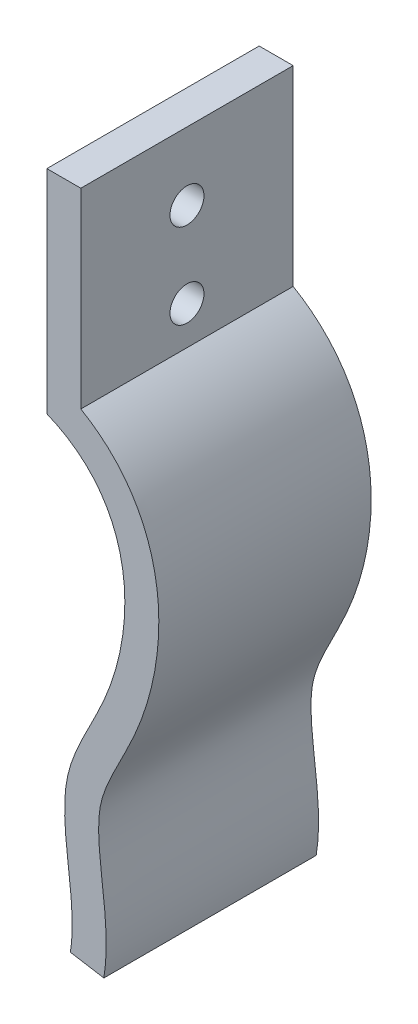
from build123d import *

# Parameters (mm, degrees)
Y_KSEKLIK_EKSTR_ZYON1_DEPTH = 25
IZIM2_R                     = 2
KES_EKSTR_ZYON1_DEPTH       = 25


with BuildPart() as part:
    # Çizim1 → Yükseklik-Ekstrüzyon1 (new body)
    with BuildSketch(Plane.XY):
        with BuildLine():
            Line((0, 46.809932088), (0, 21.809932088))
            add(Edge.make_bspline(
                [(0, 21.809932088), (10.568682784, 17.485267601), (10.861510075, 0.820586193), (0.998345772, -13.725400391), (2.795894005, -23.640205996), (3.121098113, -29.579949129), (2.768427288, -31.706876061)],
                knots=[0, 0, 0, 0, 0.502231834, 0.695448005, 0.885832632, 1, 1, 1, 1], degree=3))
            Line((2.768427288, -31.706876061), (6.714548286, -32.36119179))
            add(Edge.make_bspline(
                [(4, 24.2963952), (4.685241485, 23.900375179), (6.022043302, 23.011317955), (8.333925315, 20.992557914), (10.609017408, 18.030861677), (12.32636561, 14.066160517), (13.159459329, 9.910750093), (13.24989148, 5.701775618), (12.718641949, 1.530842244), (11.833086969, -1.848590972), (10.899012363, -4.452139312), (9.810416195, -6.984529937), (8.372727065, -9.758751694), (7.204267261, -12.146452944), (6.575072484, -13.855163917), (6.277947315, -15.001021013), (6.121386741, -16.210975711), (6.065175757, -18.048049204), (6.266564263, -20.67501448), (6.722421217, -24.235274395), (7.01194691, -27.479985961), (6.982841835, -30.215107384), (6.831247592, -31.657388466), (6.714548286, -32.36119179)],
                knots=[0.033864542, 0.033864542, 0.033864542, 0.033864542, 0.064056275, 0.094248008, 0.154631474, 0.21501494, 0.275398406, 0.335781873, 0.396165339, 0.456548805, 0.486740538, 0.516932271, 0.577315737, 0.637699203, 0.667890936, 0.698082669, 0.728274402, 0.758466135, 0.818849602, 0.879233068, 0.939616534, 0.969808267, 1, 1, 1, 1], degree=3))
            Line((4, 24.2963952), (4, 46.809932088))
            Line((4, 46.809932088), (0, 46.809932088))
        make_face()
    extrude(amount=Y_KSEKLIK_EKSTR_ZYON1_DEPTH)

    # Çizim2 → Kes-Ekstrüzyon1 (cut)
    with BuildSketch(Plane(origin=(4, 0, 0), x_dir=(0, 0, -1), z_dir=(1, 0, 0))):
        with Locations((-12.5, 38.809932088)):
            Circle(IZIM2_R)
        with Locations((-12.5, 28.809932088)):
            Circle(IZIM2_R)
    extrude(amount=-KES_EKSTR_ZYON1_DEPTH, mode=Mode.SUBTRACT)


solid = part.part
